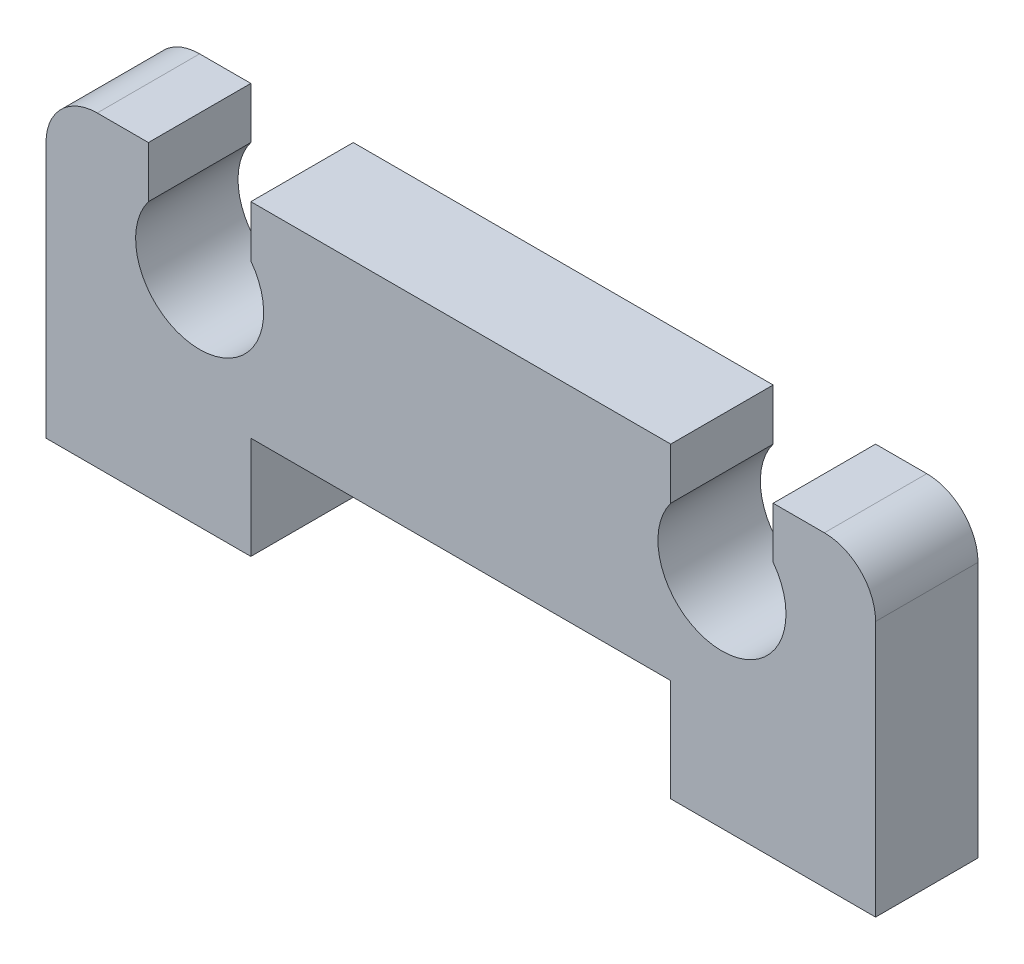
from build123d import *

# Parameters (mm, degrees)
BOSS_EXTRUDE1_DEPTH = 2


with BuildPart() as part:
    # Sketch1 → Boss-Extrude1 (new body)
    with BuildSketch(Plane.XY):
        with BuildLine():
            Line((4, 6), (12.2, 6))
            Line((12.2, 6), (12.2, 5))
            ThreePointArc((12.2, 5), (13.2, 3), (14.2, 5))
            Line((14.2, 5), (14.2, 6))
            Line((14.2, 6), (15.2, 6))
            ThreePointArc((15.2, 6), (15.907106781, 5.707106781), (16.2, 5))
            Line((16.2, 5), (16.2, 0))
            Line((16.2, 0), (12.2, 0))
            Line((12.2, 0), (12.2, 2))
            Line((12.2, 2), (4, 2))
            Line((4, 2), (4, 0))
            Line((4, 0), (0, 0))
            Line((0, 0), (0, 5))
            ThreePointArc((0, 5), (0.292893219, 5.707106781), (1, 6))
            Line((1, 6), (2, 6))
            Line((2, 6), (2, 5))
            ThreePointArc((2, 5), (3, 3), (4, 5))
            Line((4, 5), (4, 6))
        make_face()
    extrude(amount=BOSS_EXTRUDE1_DEPTH)


solid = part.part
